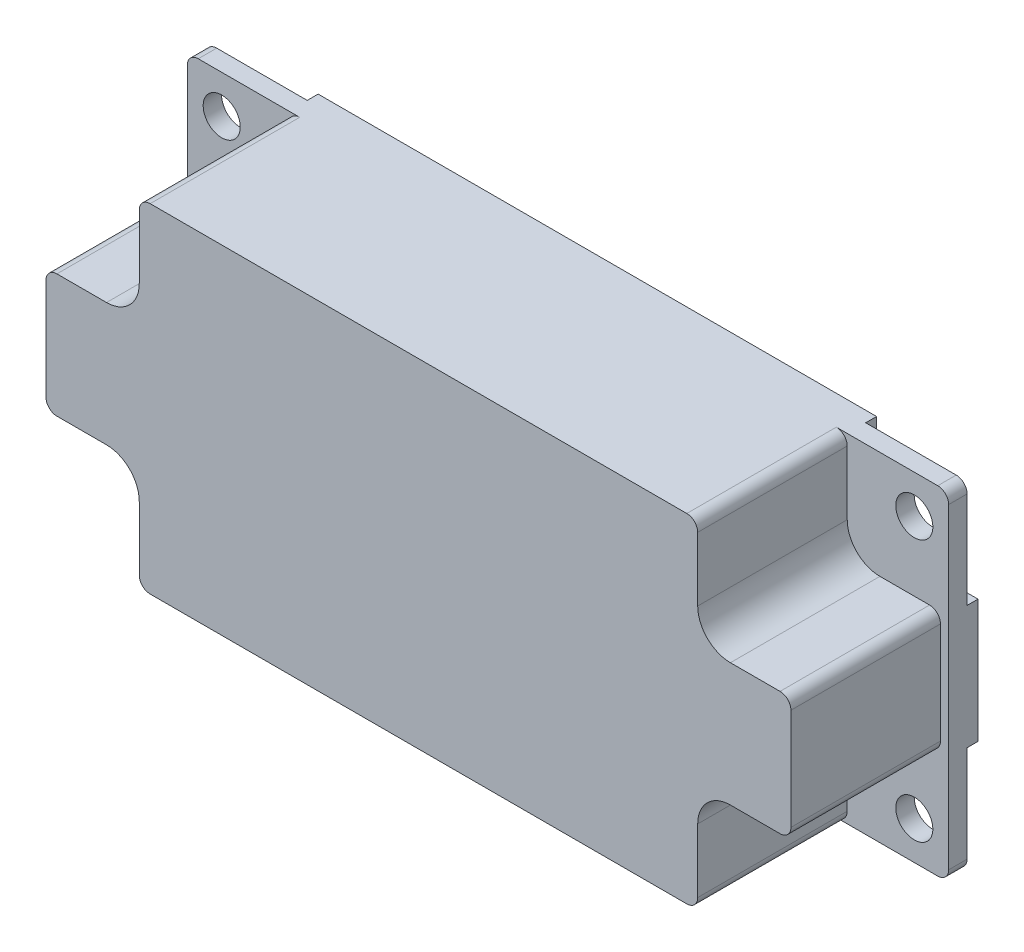
from build123d import *

# Parameters (mm, degrees)
SKETCH_1_W          = 69.8
SKETCH_1_H          = 31
EXTRUDE_1_DEPTH     = 16.4
SKETCH_2_W          = 9.3
SKETCH_2_H          = 9.85
CUT_EXTRUDE_1_DEPTH = 1
SKETCH_3_W          = 9.3
SKETCH_3_H          = 9.85
CUT_EXTRUDE_2_DEPTH = 13.71
CUT_EXTRUDE_3_DEPTH = 2
HOLE_WIZARD_M3_1_D  = 3.4
SKETCH_8_W          = 0.75
SKETCH_8_H          = 11.3
CUT_EXTRUDE_5_DEPTH = 13.71
SKETCH_9_R          = 0.437276748
EXTRUDE_3_DEPTH     = 2
FILLET_1_R          = 3
FILLET_2_R          = 1


with BuildPart() as part:
    # 草图1 → 凸台-拉伸1 (new body)
    with BuildSketch(Plane.XY):
        Rectangle(SKETCH_1_W, SKETCH_1_H)
    extrude(amount=EXTRUDE_1_DEPTH)

    # 草图2 → 切除-拉伸1 (cut)
    with BuildSketch(Plane(origin=(0, 0, 0), x_dir=(-1, 0, 0), z_dir=(0, 0, -1))):
        with Locations((-30.25, 10.575)):
            Rectangle(SKETCH_2_W, SKETCH_2_H)
        with Locations((-30.25, -10.575)):
            Rectangle(SKETCH_2_W, SKETCH_2_H)
        with Locations((30.25, -10.575)):
            Rectangle(SKETCH_2_W, SKETCH_2_H)
        with Locations((30.25, 10.575)):
            Rectangle(SKETCH_2_W, SKETCH_2_H)
    extrude(amount=-CUT_EXTRUDE_1_DEPTH, mode=Mode.SUBTRACT)

    # 草图3 → 切除-拉伸2 (cut)
    with BuildSketch(Plane.XY.offset(16.4)):
        with Locations((30.25, -10.575)):
            Rectangle(SKETCH_3_W, SKETCH_3_H)
        with Locations((-30.25, -10.575)):
            Rectangle(SKETCH_3_W, SKETCH_3_H)
        with Locations((30.25, 10.575)):
            Rectangle(SKETCH_3_W, SKETCH_3_H)
        with Locations((-30.25, 10.575)):
            Rectangle(SKETCH_3_W, SKETCH_3_H)
    extrude(amount=-CUT_EXTRUDE_2_DEPTH, mode=Mode.SUBTRACT)

    # 草图4 → 切除-拉伸3 (cut)
    with BuildSketch(Plane(origin=(0, 0, 0), x_dir=(-1, 0, 0), z_dir=(0, 0, -1))):
        with BuildLine():
            Line((-2.1, 13.6), (9, 13.6))
            ThreePointArc((9, 13.6), (22.6, 0), (9, -13.6))
            Line((9, -13.6), (-2.1, -13.6))
            ThreePointArc((-2.1, -13.6), (-15.7, 0), (-2.1, 13.6))
        make_face()
    extrude(amount=-CUT_EXTRUDE_3_DEPTH, mode=Mode.SUBTRACT)

    # M3 间隙孔1 (through all)
    with Locations(Plane(origin=(0, 0, 1), x_dir=(-1, 0, 0), z_dir=(0, 0, -1))):
        with Locations((31.75, 12), (31.75, -12), (-31.75, -12), (-31.75, 12)):
            Hole(HOLE_WIZARD_M3_1_D / 2)

    # 草图8 → 切除-拉伸5 (cut)
    with BuildSketch(Plane.XY.offset(16.4)):
        with Locations((-34.525, 0)):
            Rectangle(SKETCH_8_W, SKETCH_8_H)
        with Locations((34.525, 0)):
            Rectangle(SKETCH_8_W, SKETCH_8_H)
    extrude(amount=-CUT_EXTRUDE_5_DEPTH, mode=Mode.SUBTRACT)

    # 草图9 → 凸台-拉伸3 (add)
    with BuildSketch(Plane.ZY.offset(34.15)):
        with Locations(Location((6.232254634, 0, 0), (0, 0, 180))):
            Circle(SKETCH_9_R)
        with Locations(Location((7.500357203, 0, 0), (0, 0, 180))):
            Circle(SKETCH_9_R)
    extrude(amount=EXTRUDE_3_DEPTH)

    # 圆角1
    # the kernel refuses this fillet: 3 mm, written as the material it adds along each edge
    with BuildSketch(Plane(origin=(-9, -13.6, 2), x_dir=(0, 0, -1), z_dir=(1, 0, 0)), Plane(origin=(2.1, 13.6, 2), x_dir=(0, 0, -1), z_dir=(-1, 0, 0))) as fillet_1_piece_1:
        with BuildLine():
            CenterArc((3, 2.828427125), FILLET_1_R, 180, 70.528779366)
            Line((0, 2.828427125), (-0.06, 2.828427125))
            Line((-0.06, 2.828427125), (-0.06, 0))
            Line((-0.06, 0), (0, -0.06))
            ThreePointArc((0, -0.06), (1, -0.06), (1.98, -0.056568542))
            Line((1.98, -0.056568542), (2, 0))
        make_face()
    extrude(amount=11.1)
    with BuildSketch(Plane(origin=(2.1, 0, 2), x_dir=(0, -1, 0), z_dir=(-1, 0, 0))) as fillet_1_piece_2:
        with BuildLine():
            CenterArc((10.771572875, -3), FILLET_1_R, 19.471220634, 70.528779366)
            Line((10.771572875, 0), (10.771572875, 0.06))
            Line((10.771572875, 0.06), (13.6, 0.06))
            Line((13.6, 0.06), (13.66, 0))
            ThreePointArc((13.66, 0), (13.66, -1), (13.656568542, -1.98))
            Line((13.656568542, -1.98), (13.6, -2))
        make_face()
    revolve(axis=Axis((2.1, 0, 2), (0, 0, 1)), revolution_arc=180)
    with BuildSketch(Plane(origin=(-9, 0, 2), x_dir=(0, 1, 0), z_dir=(1, 0, 0))) as fillet_1_piece_3:
        with BuildLine():
            CenterArc((10.771572875, -3), FILLET_1_R, 19.471220634, 70.528779366)
            Line((10.771572875, 0), (10.771572875, 0.06))
            Line((10.771572875, 0.06), (13.6, 0.06))
            Line((13.6, 0.06), (13.66, 0))
            ThreePointArc((13.66, 0), (13.66, -1), (13.656568542, -1.98))
            Line((13.656568542, -1.98), (13.6, -2))
        make_face()
    revolve(axis=Axis((-9, 0, 2), (0, 0, 1)), revolution_arc=180)
    with BuildSketch(Plane(origin=(-25.6, -5.65, 0), x_dir=(0, -1, 0), z_dir=(0, 0, 1)), Plane(origin=(-25.6, 5.65, 0), x_dir=(-1, 0, 0), z_dir=(0, 0, 1))) as fillet_1_piece_4:
        with BuildLine():
            CenterArc((FILLET_1_R, -FILLET_1_R), FILLET_1_R, 90, 90)
            Line((0, -FILLET_1_R), (-FILLET_1_R * 0.02, -FILLET_1_R))
            Line((-FILLET_1_R * 0.02, -FILLET_1_R), (-FILLET_1_R * 0.02, FILLET_1_R * 0.02))
            Line((-FILLET_1_R * 0.02, FILLET_1_R * 0.02), (FILLET_1_R, FILLET_1_R * 0.02))
            Line((FILLET_1_R, FILLET_1_R * 0.02), (FILLET_1_R, 0))
        make_face()
    extrude(amount=8.5)
    with BuildSketch(Plane(origin=(25.6, -5.65, 0), x_dir=(0, -1, 0), z_dir=(0, 0, 1)), Plane(origin=(25.6, 5.65, 0), x_dir=(1, 0, 0), z_dir=(0, 0, 1))) as fillet_1_piece_5:
        with BuildLine():
            CenterArc((FILLET_1_R, FILLET_1_R), FILLET_1_R, 180, 90)
            Line((0, FILLET_1_R), (-FILLET_1_R * 0.02, FILLET_1_R))
            Line((-FILLET_1_R * 0.02, FILLET_1_R), (-FILLET_1_R * 0.02, -FILLET_1_R * 0.02))
            Line((-FILLET_1_R * 0.02, -FILLET_1_R * 0.02), (FILLET_1_R, -FILLET_1_R * 0.02))
            Line((FILLET_1_R, -FILLET_1_R * 0.02), (FILLET_1_R, 0))
        make_face()
    extrude(amount=8.5)
    with BuildSketch(Plane(origin=(-25.6, 5.65, 16.4), x_dir=(-1, 0, 0), z_dir=(0, 0, -1))) as fillet_1_piece_6_section:
        with BuildLine():
            CenterArc((FILLET_1_R, FILLET_1_R), FILLET_1_R, 180, 90)
            Line((0, FILLET_1_R), (-FILLET_1_R * 0.02, FILLET_1_R))
            Line((-FILLET_1_R * 0.02, FILLET_1_R), (-FILLET_1_R * 0.02, -FILLET_1_R * 0.02))
            Line((-FILLET_1_R * 0.02, -FILLET_1_R * 0.02), (FILLET_1_R, -FILLET_1_R * 0.02))
            Line((FILLET_1_R, -FILLET_1_R * 0.02), (FILLET_1_R, 0))
        make_face()
    fillet_1_piece_6 = extrude(amount=21.21, mode=Mode.PRIVATE)
    fillet_1_piece_6 = split(fillet_1_piece_6, bisect_by=Plane(origin=(-26.279185343, 6.329185343, 0), z_dir=(0, 0, 1)), keep=Keep.TOP, mode=Mode.PRIVATE)
    add(fillet_1_piece_6)
    with BuildSketch(Plane(origin=(25.6, 5.65, 16.4), x_dir=(1, 0, 0), z_dir=(0, 0, -1))) as fillet_1_piece_7_section:
        with BuildLine():
            CenterArc((FILLET_1_R, -FILLET_1_R), FILLET_1_R, 90, 90)
            Line((0, -FILLET_1_R), (-FILLET_1_R * 0.02, -FILLET_1_R))
            Line((-FILLET_1_R * 0.02, -FILLET_1_R), (-FILLET_1_R * 0.02, FILLET_1_R * 0.02))
            Line((-FILLET_1_R * 0.02, FILLET_1_R * 0.02), (FILLET_1_R, FILLET_1_R * 0.02))
            Line((FILLET_1_R, FILLET_1_R * 0.02), (FILLET_1_R, 0))
        make_face()
    fillet_1_piece_7 = extrude(amount=21.21, mode=Mode.PRIVATE)
    fillet_1_piece_7 = split(fillet_1_piece_7, bisect_by=Plane(origin=(26.279185343, 6.329185343, 0), z_dir=(0, 0, 1)), keep=Keep.TOP, mode=Mode.PRIVATE)
    add(fillet_1_piece_7)
    with BuildSketch(Plane(origin=(25.6, -5.65, 16.4), x_dir=(0, -1, 0), z_dir=(0, 0, -1))) as fillet_1_piece_8_section:
        with BuildLine():
            CenterArc((FILLET_1_R, -FILLET_1_R), FILLET_1_R, 90, 90)
            Line((0, -FILLET_1_R), (-FILLET_1_R * 0.02, -FILLET_1_R))
            Line((-FILLET_1_R * 0.02, -FILLET_1_R), (-FILLET_1_R * 0.02, FILLET_1_R * 0.02))
            Line((-FILLET_1_R * 0.02, FILLET_1_R * 0.02), (FILLET_1_R, FILLET_1_R * 0.02))
            Line((FILLET_1_R, FILLET_1_R * 0.02), (FILLET_1_R, 0))
        make_face()
    fillet_1_piece_8 = extrude(amount=21.21, mode=Mode.PRIVATE)
    fillet_1_piece_8 = split(fillet_1_piece_8, bisect_by=Plane(origin=(26.279185343, -6.329185343, 0), z_dir=(0, 0, 1)), keep=Keep.TOP, mode=Mode.PRIVATE)
    add(fillet_1_piece_8)
    with BuildSketch(Plane(origin=(-25.6, -5.65, 16.4), x_dir=(0, -1, 0), z_dir=(0, 0, -1))) as fillet_1_piece_9_section:
        with BuildLine():
            CenterArc((FILLET_1_R, FILLET_1_R), FILLET_1_R, 180, 90)
            Line((0, FILLET_1_R), (-FILLET_1_R * 0.02, FILLET_1_R))
            Line((-FILLET_1_R * 0.02, FILLET_1_R), (-FILLET_1_R * 0.02, -FILLET_1_R * 0.02))
            Line((-FILLET_1_R * 0.02, -FILLET_1_R * 0.02), (FILLET_1_R, -FILLET_1_R * 0.02))
            Line((FILLET_1_R, -FILLET_1_R * 0.02), (FILLET_1_R, 0))
        make_face()
    fillet_1_piece_9 = extrude(amount=21.21, mode=Mode.PRIVATE)
    fillet_1_piece_9 = split(fillet_1_piece_9, bisect_by=Plane(origin=(-26.279185343, -6.329185343, 0), z_dir=(0, 0, 1)), keep=Keep.TOP, mode=Mode.PRIVATE)
    add(fillet_1_piece_9)

    # 圆角2
    fillet_2_edges = [part.edges().sort_by_distance(p)[0] for p in [
        (-25.6, 15.5, 9.545),
        (-34.15, -5.65, 9.545),
        (-34.15, 5.65, 9.545),
        (34.15, 5.65, 9.545),
        (34.15, -5.65, 9.545),
        (34.9, -15.5, 1.845),
        (25.6, -15.5, 9.545),
        (-34.9, 15.5, 1.845),
        (34.9, 15.5, 1.845),
        (-34.9, -15.5, 1.845),
        (25.6, 15.5, 9.545),
        (-25.6, -15.5, 9.545),
    ]]
    fillet(fillet_2_edges, radius=FILLET_2_R)


solid = part.part
